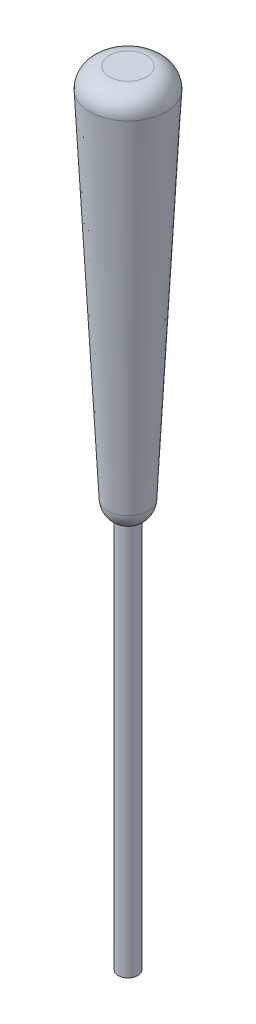
from build123d import *

# Parameters (mm, degrees)
SKETCH1_R           = 2.5
BOSS_EXTRUDE1_DEPTH = 100
SKETCH3_R           = 10
SKETCH2_R           = 5
FILLET1_R           = 5


with BuildPart() as part:
    # Sketch1 → Boss-Extrude1 (new body)
    with BuildSketch(Plane(origin=(0, 0, 0), x_dir=(1, 0, 0), z_dir=(0, 1, 0))):
        with Locations(Location((0, 0, 0), (0, 0, 90))):
            Circle(SKETCH1_R)
    extrude(amount=BOSS_EXTRUDE1_DEPTH)

    # Sketch3 → Loft1 section 0
    with BuildSketch(Plane(origin=(0, 200, 0), x_dir=(1, 0, 0), z_dir=(0, 1, 0))):
        Circle(SKETCH3_R)
    # Sketch2 → Loft1 section 1
    with BuildSketch(Plane(origin=(0, 100, 0), x_dir=(1, 0, 0), z_dir=(0, 1, 0))):
        Circle(SKETCH2_R)
    loft()

    # Fillet1
    # the kernel refuses this fillet: 5 mm, written as the material it takes off along each edge
    with BuildSketch(Plane(origin=(0, 200, 0), x_dir=(1, 0, 0), z_dir=(0, 0, 1))) as fillet1_piece_1:
        with BuildLine():
            CenterArc((10 - FILLET1_R * 1.05124921973, -FILLET1_R), FILLET1_R, 357.137594774, 92.862405226)
            Line((10 - FILLET1_R * 1.05124921973, 0), (10 - FILLET1_R * 1.05124921973, FILLET1_R * 0.02))
            Line((10 - FILLET1_R * 1.05124921973, FILLET1_R * 0.02), (10 + FILLET1_R * 0.0210249843945, FILLET1_R * 0.02))
            Line((10 + FILLET1_R * 0.0210249843945, FILLET1_R * 0.02), (10 - FILLET1_R * 0.0325218340696, -FILLET1_R * 1.05093636928))
            Line((10 - FILLET1_R * 0.0325218340696, -FILLET1_R * 1.05093636928), (10 - FILLET1_R * 0.0524968808472, -FILLET1_R * 1.04993761694))
        make_face()
    revolve(axis=Axis((0, 200, 0), (0, 1, 0)), mode=Mode.SUBTRACT)
    with BuildSketch(Plane(origin=(0, 100, 0), x_dir=(1, 0, 0), z_dir=(0, 0, 1))) as fillet1_piece_2:
        with BuildLine():
            CenterArc((0.216150111, 4.4479242), FILLET1_R, 297.178875661, 59.958719113)
            Line((2.5, 0), (2.545676998, -0.088958484))
            ThreePointArc((2.545676998, -0.088958484), (3.75, -0.1), (5, -0.1))
            Line((5, -0.1), (5.099875234, -0.004993762))
            Line((5.099875234, -0.004993762), (5.30978704, 4.193242353))
            Line((5.30978704, 4.193242353), (5.209911806, 4.198236115))
        make_face()
    revolve(axis=Axis((0, 100, 0), (0, 1, 0)), mode=Mode.SUBTRACT)


solid = part.part
